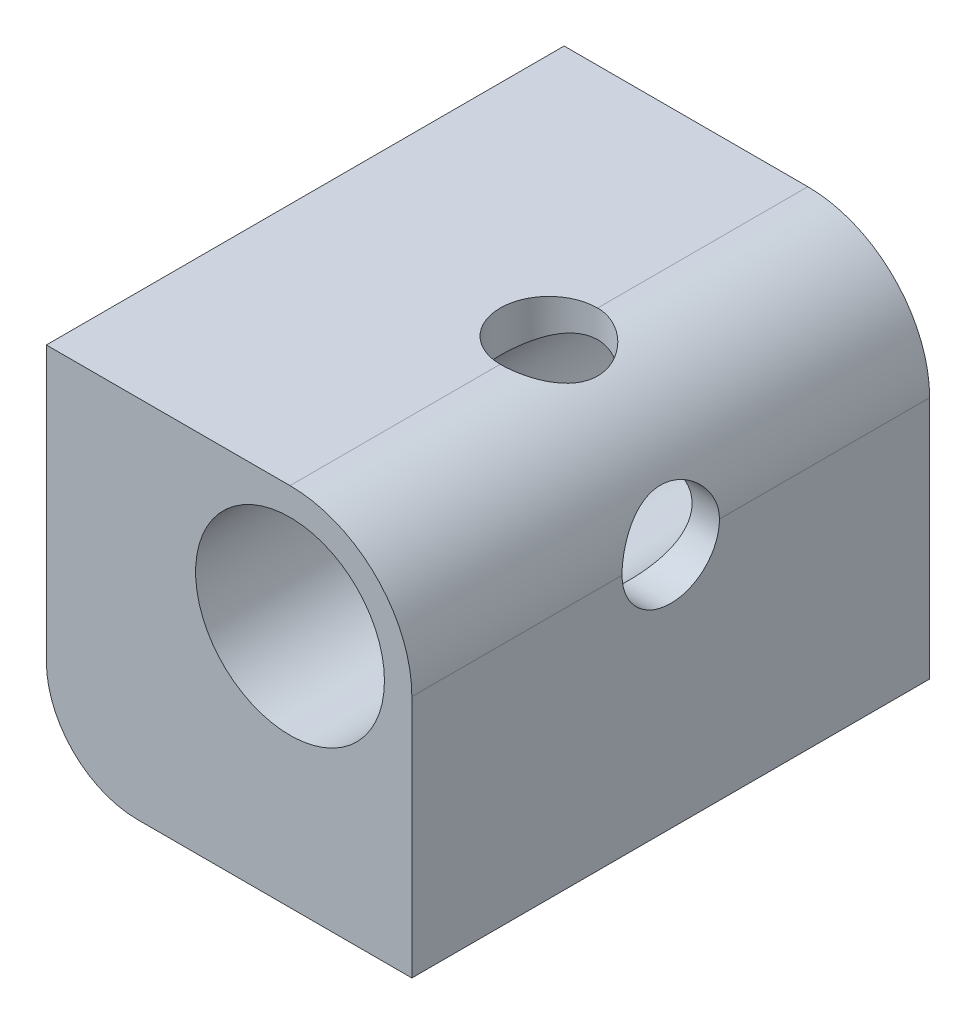
from build123d import *

# Parameters (mm, degrees)
SKETCH_1_W          = 14
SKETCH_1_H          = 14
EXTRUDE_1_DEPTH     = 17
SKETCH_2_R          = 3.1
CUT_EXTRUDE_1_DEPTH = 20.672315573
FILLET_1_R          = 5
CUT_EXTRUDE_2_DEPTH = 17
SKETCH_4_R          = 1.6
CUT_EXTRUDE_3_DEPTH = 17
SKETCH_5_R          = 1.6
CUT_EXTRUDE_4_DEPTH = 17
FILLET_2_R          = 4


with BuildPart() as part:
    # ｽｹｯﾁ1 → ﾎﾞｽ - 押し出し1 (new body)
    with BuildSketch(Plane.XY):
        Rectangle(SKETCH_1_W, SKETCH_1_H)
    extrude(amount=EXTRUDE_1_DEPTH)

    # ｽｹｯﾁ2 → ｶｯﾄ - 押し出し1 (cut, through all)
    with BuildSketch(Plane.XY.offset(17)):
        with Locations((3, 3)):
            Circle(SKETCH_2_R)
    extrude(amount=-CUT_EXTRUDE_1_DEPTH, mode=Mode.SUBTRACT)

    # ﾌｨﾚｯﾄ1
    fillet_1_edges = [part.edges().sort_by_distance(p)[0] for p in [
        (-7, -7, 8.5),
    ]]
    fillet(fillet_1_edges, radius=FILLET_1_R)

    # ｽｹｯﾁ3 → ｶｯﾄ - 押し出し2 (cut)
    with BuildSketch(Plane.XY.offset(17)):
        with BuildLine():
            Line((-7, 7), (-7, -7))
            Line((-7, -7), (7, -7))
            Line((7, -7), (7, -5))
            Line((7, -5), (-2, -5))
            ThreePointArc((-2, -5), (-4.121320344, -4.121320344), (-5, -2))
            Line((-5, -2), (-5, 7))
            Line((-5, 7), (-7, 7))
        make_face()
    extrude(amount=-CUT_EXTRUDE_2_DEPTH, mode=Mode.SUBTRACT)

    # ｽｹｯﾁ4 → ｶｯﾄ - 押し出し3 (cut)
    with BuildSketch(Plane.XZ.offset(5)):
        with Locations(Location((3, 8.5, 0), (0, 0, 270))):
            Circle(SKETCH_4_R)
    extrude(amount=-CUT_EXTRUDE_3_DEPTH, mode=Mode.SUBTRACT)

    # ｽｹｯﾁ5 → ｶｯﾄ - 押し出し4 (cut)
    with BuildSketch(Plane.ZY.offset(5)):
        with Locations((8.5, 3)):
            Circle(SKETCH_5_R)
    extrude(amount=-CUT_EXTRUDE_4_DEPTH, mode=Mode.SUBTRACT)

    # ﾌｨﾚｯﾄ2
    # the kernel refuses this fillet: 4 mm, written as the material it takes off along each edge
    with BuildSketch(Plane(origin=(7, 7, -10), x_dir=(-1, 0, 0), z_dir=(0, 0, 1))) as fillet_2_piece_1:
        with BuildLine():
            CenterArc((FILLET_2_R, FILLET_2_R), FILLET_2_R, 180, 90)
            Line((0, FILLET_2_R), (0, 0))
            Line((0, 0), (FILLET_2_R, 0))
        make_face()
    extrude(amount=37, mode=Mode.SUBTRACT)


solid = part.part
